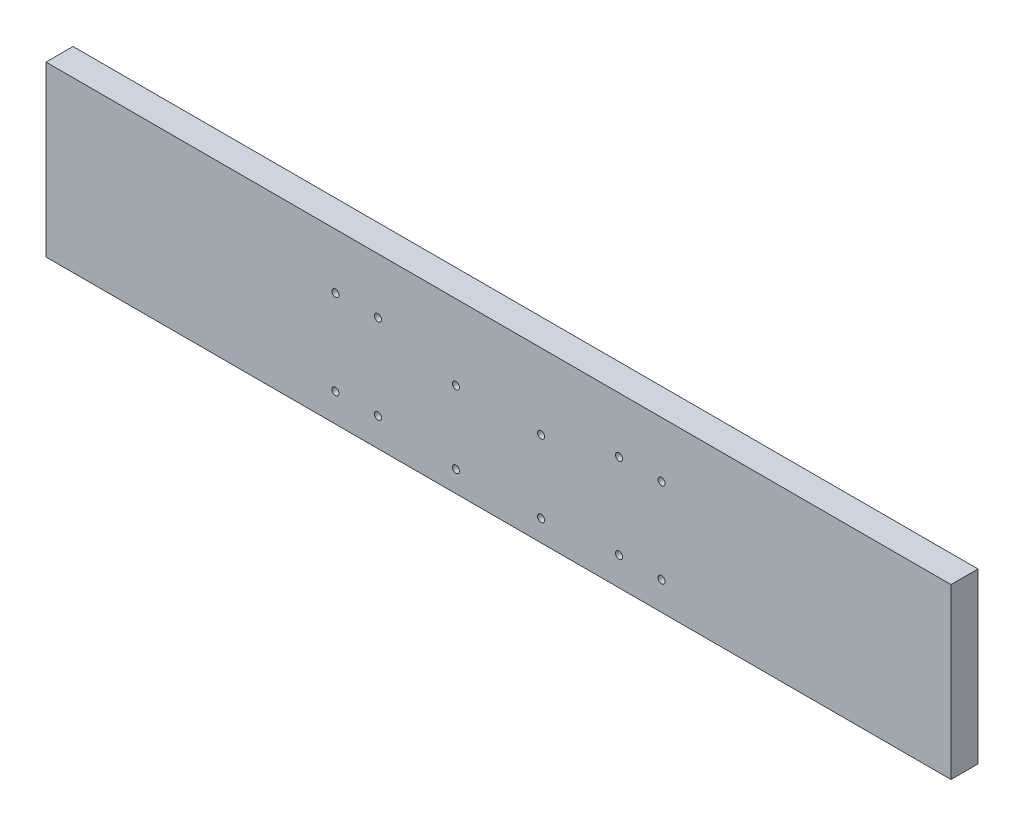
from build123d import *

# Parameters (mm, degrees)
SKETCH1_W                 = 638.1
SKETCH1_H                 = 119.05
BOSS_EXTRUDE1_DEPTH       = 19.05
F_5_0MM_DOWEL_HOLE1_D     = 5
F_5_0MM_DOWEL_HOLE1_DEPTH = 28.497848452
F_5_0MM_DOWEL_HOLE1_TIP   = 1.502151548


with BuildPart() as part:
    # Sketch1 → Boss-Extrude1 (new body)
    with BuildSketch(Plane.XY):
        with Locations((-319.05, 59.525)):
            Rectangle(SKETCH1_W, SKETCH1_H)
    extrude(amount=BOSS_EXTRUDE1_DEPTH)

    # Ø5.0mm Dowel Hole1
    with Locations(Plane(origin=(0, 0, 0), x_dir=(-1, 0, 0), z_dir=(0, 0, -1))):
        with Locations((434.05, 20), (404.05, 20), (404.05, 80), (434.05, 80), (349.05, 15), (349.05, 66), (289.05, 66), (289.05, 15), (234.05, 20), (234.05, 80), (204.05, 80), (204.05, 20)):
            Hole(F_5_0MM_DOWEL_HOLE1_D / 2, depth=F_5_0MM_DOWEL_HOLE1_DEPTH)
            with Locations((0, 0, -(F_5_0MM_DOWEL_HOLE1_DEPTH + F_5_0MM_DOWEL_HOLE1_TIP / 2))):  # 118° drill point
                Cone(0, F_5_0MM_DOWEL_HOLE1_D / 2, F_5_0MM_DOWEL_HOLE1_TIP, mode=Mode.SUBTRACT)


solid = part.part
